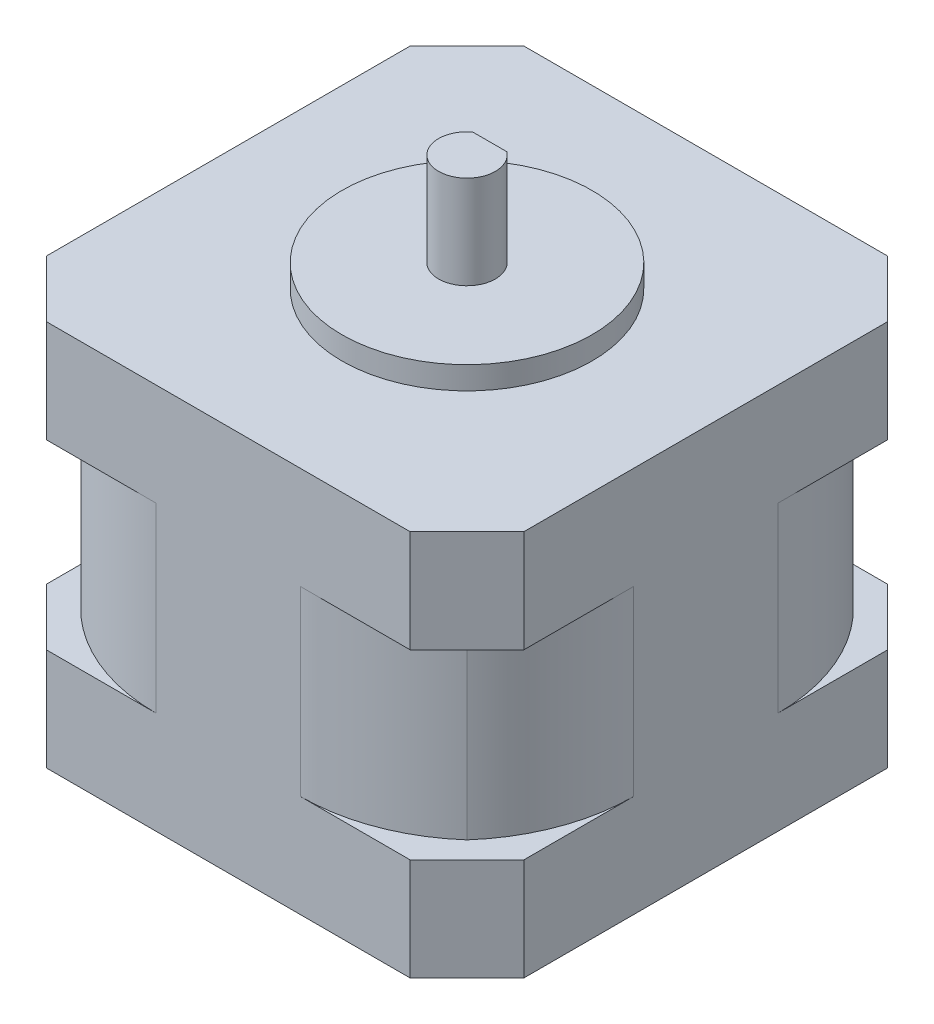
from build123d import *

# Parameters (mm, degrees)
SKETCH_1_W               = 42
SKETCH_1_H               = 42
EXTRUDE_1_DEPTH          = 17
CUT_EXTRUDE_1_DEPTH      = 8
PATTERN_CIRCULAR_1_COUNT = 4
FILLET_1_R               = 16
CHAMFER_1_SIZE           = 5
SKETCH_3_R               = 11
EXTRUDE_2_DEPTH          = 2
EXTRUDE_3_DEPTH          = 8.2


with BuildPart() as part:
    # 스케치1 → 보스-돌출1 (new, symmetric)
    with BuildSketch(Plane(origin=(0, 0, 0), x_dir=(1, 0, 0), z_dir=(0, 1, 0))):
        Rectangle(SKETCH_1_W, SKETCH_1_H)
    extrude(amount=EXTRUDE_1_DEPTH, both=True)

    # 스케치2 → 컷-돌출1 (cut, symmetric)
    with BuildSketch(Plane(origin=(0, 0, 0), x_dir=(1, 0, 0), z_dir=(0, 1, 0))):
        Polygon((-21, 13), (-13, 21), (-21, 21), align=None)
    cut_extrude_1 = extrude(amount=CUT_EXTRUDE_1_DEPTH, both=True, mode=Mode.SUBTRACT)

    # 원형 패턴1: 컷-돌출1 ×4 about axis
    pattern_circular_1_axis = Axis((0, 0, 0), (0, 1, 0))
    for i in range(1, PATTERN_CIRCULAR_1_COUNT):
        add(cut_extrude_1.rotate(pattern_circular_1_axis, i * 360 / PATTERN_CIRCULAR_1_COUNT), mode=Mode.SUBTRACT)

    # 필렛1
    # the kernel refuses this fillet: 16 mm, written as the material it takes off along each edge
    with BuildSketch(Plane(origin=(21, -8, -13), x_dir=(0, 0, 1), z_dir=(0, 1, 0)), Plane(origin=(13, 8, -21), x_dir=(-1, 0, 0), z_dir=(0, -1, 0)), Plane(origin=(-21, 8, -13), x_dir=(0, 0, 1), z_dir=(0, -1, 0)), Plane(origin=(-13, 8, 21), x_dir=(1, 0, 0), z_dir=(0, -1, 0)), Plane(origin=(13, -8, 21), x_dir=(-1, 0, 0), z_dir=(0, 1, 0)), Plane(origin=(21, 8, 13), x_dir=(0, 0, -1), z_dir=(0, -1, 0))) as fillet_1_piece_1:
        with BuildLine():
            CenterArc((FILLET_1_R * 0.414213562373, -FILLET_1_R), FILLET_1_R, 90, 45)
            Line((-FILLET_1_R * 0.292893218813, -FILLET_1_R * 0.292893218813), (0, 0))
            Line((0, 0), (FILLET_1_R * 0.414213562373, 0))
        make_face()
    extrude(amount=16, mode=Mode.SUBTRACT)
    with BuildSketch(Plane(origin=(-13, -8, -21), x_dir=(-0.7071067811865475, 0, 0.7071067811865477), z_dir=(0, 1, 0)), Plane(origin=(-21, -8, 13), x_dir=(0.7071067811865472, 0, 0.7071067811865478), z_dir=(0, 1, 0))) as fillet_1_piece_2:
        with BuildLine():
            CenterArc((FILLET_1_R * 0.414213562373, FILLET_1_R), FILLET_1_R, 225, 45)
            Line((-FILLET_1_R * 0.292893218813, FILLET_1_R * 0.292893218813), (0, 0))
            Line((0, 0), (FILLET_1_R * 0.414213562373, 0))
        make_face()
    extrude(amount=16, mode=Mode.SUBTRACT)

    # 모따기1
    chamfer_1_edges = [part.edges().sort_by_distance(p)[0] for p in [
        (-21, -12.5, -21),
        (21, -12.5, 21),
        (-21, -12.5, 21),
        (21, -12.5, -21),
        (21, 12.5, 21),
        (-21, 12.5, 21),
        (-21, 12.5, -21),
        (21, 12.5, -21),
    ]]
    chamfer(chamfer_1_edges, length=CHAMFER_1_SIZE)

    # 스케치3 → 보스-돌출2 (add)
    with BuildSketch(Plane(origin=(0, 17, 0), x_dir=(1, 0, 0), z_dir=(0, 1, 0))):
        with Locations(Location((0, 0, 0), (0, 0, 270))):
            Circle(SKETCH_3_R)
    extrude(amount=EXTRUDE_2_DEPTH)

    # 스케치4 → 보스-돌출3 (add)
    with BuildSketch(Plane(origin=(0, 19, 0), x_dir=(1, 0, 0), z_dir=(0, 1, 0))):
        with BuildLine():
            Line((0, 2), (-1.5, 2))
            ThreePointArc((-1.5, 2), (-2.371708245, -0.790569415), (0, -2.5))
            Line((0, -2.5), (0, 2))
        make_face()
        with BuildLine():
            Line((1.5, 2), (0, 2))
            Line((0, 2), (0, -2.5))
            ThreePointArc((0, -2.5), (1.767766953, -1.767766953), (2.5, 0))
            ThreePointArc((2.5, 0), (2.236067977, 1.118033989), (1.5, 2))
        make_face()
    extrude(amount=EXTRUDE_3_DEPTH)


solid = part.part
